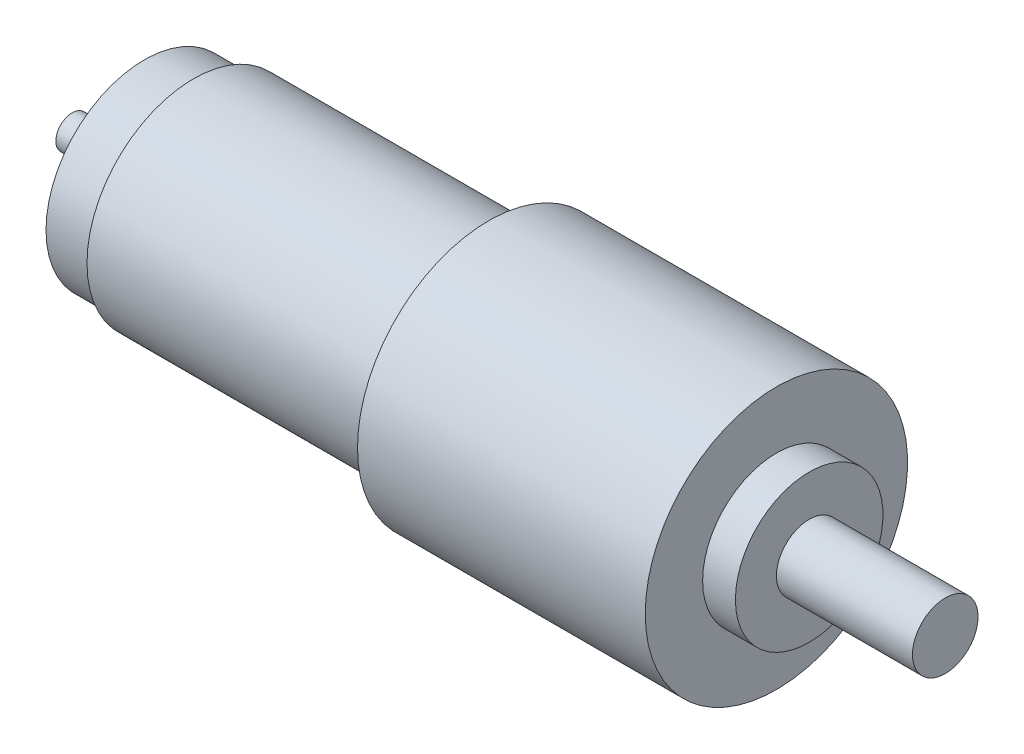
from build123d import *


with BuildPart() as part:
    # Esquisse1 → Révolution1 (revolve)
    with BuildSketch(Plane.XY):
        Polygon((0, 0), (106.5, 0), (106.5, 4), (89.9, 4), (89.9, 9), (85.9, 9), (85.9, 16), (50.8, 16), (50.8, 13), (14.8, 13), (14.8, 12), (8.8, 12), (8.8, 2), (0, 2), align=None)
    revolve(axis=Axis((0, 0, 0), (1, 0, 0)))


solid = part.part
